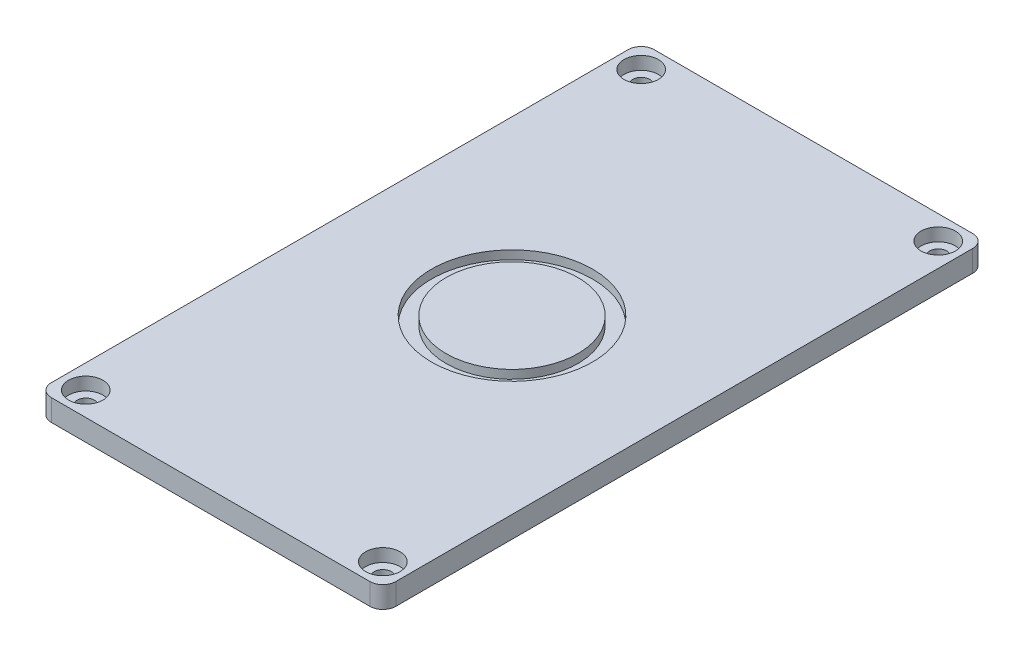
from build123d import *

# Parameters (mm, degrees)
SKETCH1_W           = 80
SKETCH1_H           = 140
BOSS_EXTRUDE1_DEPTH = 5
FILLET1_R           = 3
SKETCH2_R           = 4
CUT_EXTRUDE1_DEPTH  = 3
SKETCH3_R           = 2
CUT_EXTRUDE2_DEPTH  = 3
SKETCH4_R           = 18.707324993
SKETCH4_R_2         = 15.313080282
CUT_EXTRUDE3_DEPTH  = 2


with BuildPart() as part:
    # Sketch1 → Boss-Extrude1 (new body)
    with BuildSketch(Plane(origin=(0, 0, 0), x_dir=(1, 0, 0), z_dir=(0, 1, 0))):
        with Locations((40, 70)):
            Rectangle(SKETCH1_W, SKETCH1_H)
    extrude(amount=BOSS_EXTRUDE1_DEPTH)

    # Fillet1
    fillet1_edges = [part.edges().sort_by_distance(p)[0] for p in [
        (0, 2.5, -140),
        (80, 2.5, -140),
        (80, 2.5, 0),
        (0, 2.5, 0),
    ]]
    fillet(fillet1_edges, radius=FILLET1_R)

    # Sketch2 → Cut-Extrude1 (cut)
    with BuildSketch(Plane(origin=(0, 5, 0), x_dir=(1, 0, 0), z_dir=(0, 1, 0))):
        with Locations((5.5, 5.5)):
            Circle(SKETCH2_R)
        with Locations((74.5, 5.5)):
            Circle(SKETCH2_R)
        with Locations((74.5, 134.5)):
            Circle(SKETCH2_R)
        with Locations((5.5, 134.5)):
            Circle(SKETCH2_R)
    extrude(amount=-CUT_EXTRUDE1_DEPTH, mode=Mode.SUBTRACT)

    # Sketch3 → Cut-Extrude2 (cut)
    with BuildSketch(Plane(origin=(0, 2, 0), x_dir=(1, 0, 0), z_dir=(0, 1, 0))):
        with Locations((5.5, 5.5)):
            Circle(SKETCH3_R)
        with Locations((5.5, 134.5)):
            Circle(SKETCH3_R)
        with Locations((74.5, 5.5)):
            Circle(SKETCH3_R)
        with Locations((74.5, 134.5)):
            Circle(SKETCH3_R)
    extrude(amount=-CUT_EXTRUDE2_DEPTH, mode=Mode.SUBTRACT)

    # Sketch4 → Cut-Extrude3 (cut)
    with BuildSketch(Plane(origin=(0, 5, 0), x_dir=(1, 0, 0), z_dir=(0, 1, 0))):
        with Locations((40, 70)):
            Circle(SKETCH4_R)
        with Locations((40, 70)):
            Circle(SKETCH4_R_2, mode=Mode.SUBTRACT)
    extrude(amount=-CUT_EXTRUDE3_DEPTH, mode=Mode.SUBTRACT)


solid = part.part
